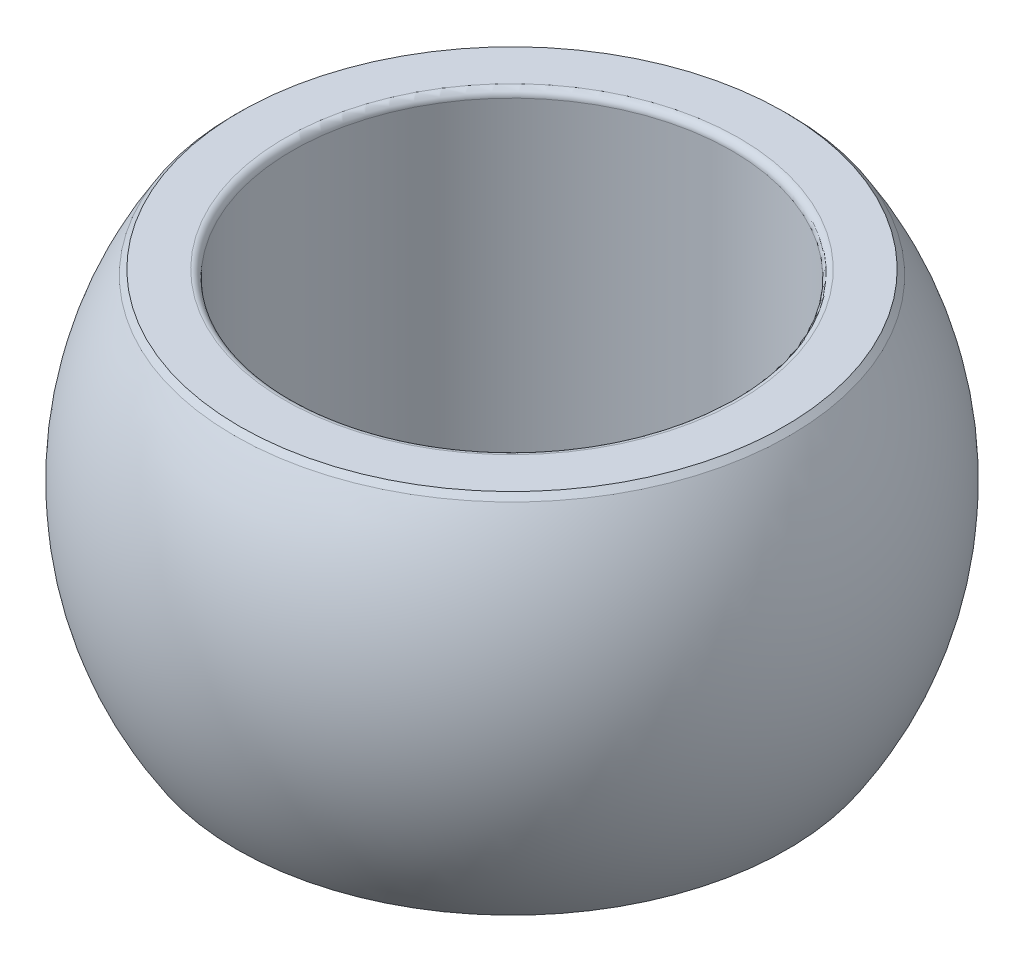
from build123d import *

# Parameters (mm, degrees)
FILLET1_R       = 0.2
CHAMFER1_SIZE   = 0.181209408
CHAMFER1_SIZE_2 = 0.05


with BuildPart() as part:
    # Sketch1 → Revolve1 (revolve)
    with BuildSketch(Plane.XY):
        with BuildLine():
            Line((-6, -5), (-6, 5))
            Line((-6, 5), (-7.483314774, 5))
            ThreePointArc((-7.483314774, 5), (-9, 0), (-7.483314774, -5))
            Line((-7.483314774, -5), (-6, -5))
        make_face()
    revolve(axis=Axis((0, 0, 0), (0, 1, 0)))

    # Fillet1
    fillet1_edges = [part.edges().sort_by_distance(p)[0] for p in [
        (6, 5, 0),
        (6, -5, 0),
    ]]
    fillet(fillet1_edges, radius=FILLET1_R)

    # Chamfer1
    # the kernel refuses this chamfer: 0.181209408, 0.05 mm, written as the material it takes off along each edge
    with BuildSketch(Plane(origin=(0, -5, 0), x_dir=(-1, 0, 0), z_dir=(0, 0, -1))) as chamfer1_piece_1:
        with BuildLine():
            Line((7.483314774 - CHAMFER1_SIZE, 0), (7.510900969, 0.041535859))
            ThreePointArc((7.510900969, 0.041535859), (7.49854981, 0.022877263), (7.483314774, 0))
            Line((7.483314774, 0), (7.483314774 - CHAMFER1_SIZE, 0))
        make_face()
    revolve(axis=Axis((0, -5, 0), (0, 1, 0)), mode=Mode.SUBTRACT)
    with BuildSketch(Plane(origin=(0, 5, 0), x_dir=(-1, 0, 0), z_dir=(0, 0, -1))) as chamfer1_piece_2:
        with BuildLine():
            Line((7.577969598, -0.144654824), (7.483314774 - CHAMFER1_SIZE_2, 0))
            Line((7.483314774 - CHAMFER1_SIZE_2, 0), (7.483314774, 0))
            ThreePointArc((7.483314774, 0), (7.532931313, -0.075068951), (7.577969598, -0.144654824))
        make_face()
    revolve(axis=Axis((0, 5, 0), (0, 1, 0)), mode=Mode.SUBTRACT)


solid = part.part
